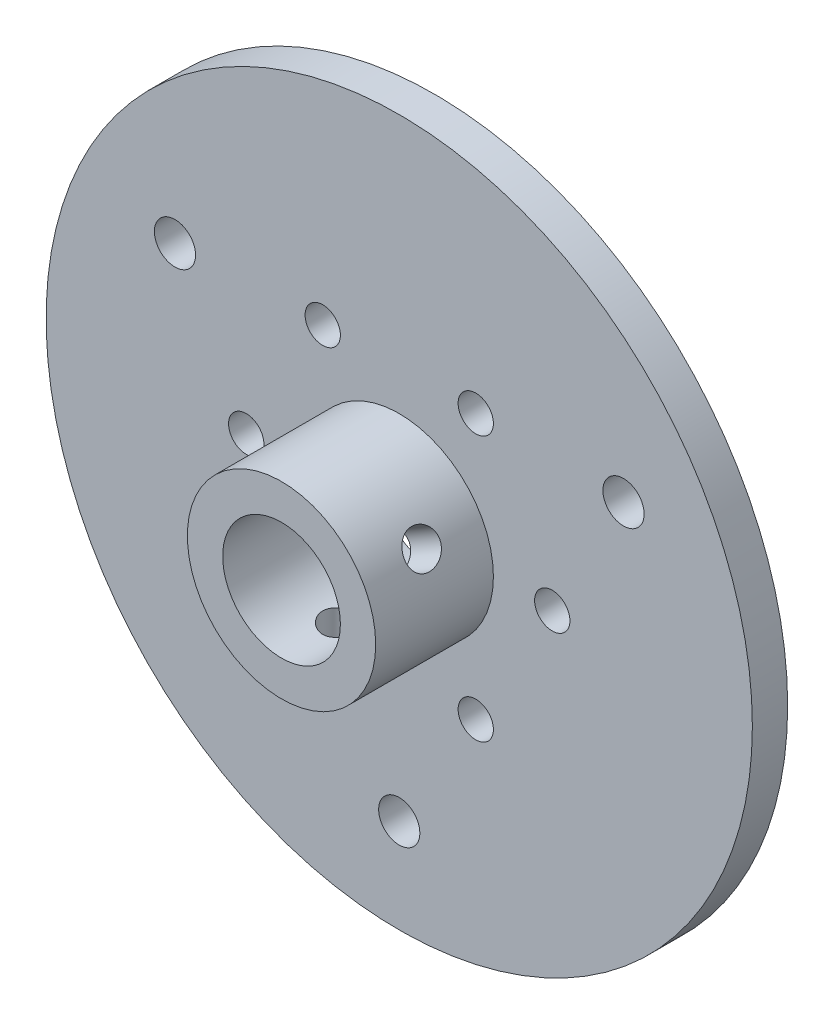
from build123d import *

# Parameters (mm, degrees)
SKETCH2_R           = 30
SKETCH2_R_2         = 5
SKETCH2_R_3         = 1.75
BOSS_EXTRUDE1_DEPTH = 3
SKETCH3_R           = 8
SKETCH3_R_2         = 5
BOSS_EXTRUDE2_DEPTH = 10
SKETCH4_R           = 1.5
CUT_EXTRUDE2_DEPTH  = 44.588989435
SKETCH12_R          = 1.5
CUT_EXTRUDE3_DEPTH  = 11.49377522
CIRPATTERN1_COUNT   = 3


with BuildPart() as part:
    # Sketch2 → Boss-Extrude1 (new body)
    with BuildSketch(Plane.XY):
        Circle(SKETCH2_R)
        Circle(SKETCH2_R_2, mode=Mode.SUBTRACT)
        with Locations((0, -22)):
            Circle(SKETCH2_R_3, mode=Mode.SUBTRACT)
        with Locations((-19.052558883, 11)):
            Circle(SKETCH2_R_3, mode=Mode.SUBTRACT)
        with Locations((19.052558883, 11)):
            Circle(SKETCH2_R_3, mode=Mode.SUBTRACT)
    extrude(amount=BOSS_EXTRUDE1_DEPTH)

    # Sketch3 → Boss-Extrude2 (add)
    with BuildSketch(Plane.XY.offset(3)):
        Circle(SKETCH3_R)
        Circle(SKETCH3_R_2, mode=Mode.SUBTRACT)
    extrude(amount=BOSS_EXTRUDE2_DEPTH)

    # Sketch4 → Cut-Extrude2 (cut, through all)
    with BuildSketch(Plane.XY.offset(3)):
        with Locations((-6.5, 11.258330249)):
            Circle(SKETCH4_R)
        with Locations((13, 0)):
            Circle(SKETCH4_R)
        with Locations((-6.5, -11.258330249)):
            Circle(SKETCH4_R)
        with Locations((6.5, 11.258330249)):
            Circle(SKETCH4_R)
        with Locations((6.5, -11.258330249)):
            Circle(SKETCH4_R)
        with Locations((-13, 0)):
            Circle(SKETCH4_R)
    extrude(amount=-CUT_EXTRUDE2_DEPTH, mode=Mode.SUBTRACT)

    # Sketch12 → Cut-Extrude3 (cut)
    with BuildSketch(Plane(origin=(0, 0, 0), x_dir=(1, 0, 0), z_dir=(0, 1, 0))):
        with Locations((0, -8)):
            Circle(SKETCH12_R)
    cut_extrude3 = extrude(amount=-CUT_EXTRUDE3_DEPTH, mode=Mode.SUBTRACT)

    # CirPattern1: Cut-Extrude3 ×3 about axis
    cirpattern1_axis = Axis((0, 0, 13), (0, 0, 1))
    for i in range(1, CIRPATTERN1_COUNT):
        add(cut_extrude3.rotate(cirpattern1_axis, i * 360 / CIRPATTERN1_COUNT), mode=Mode.SUBTRACT)


solid = part.part
